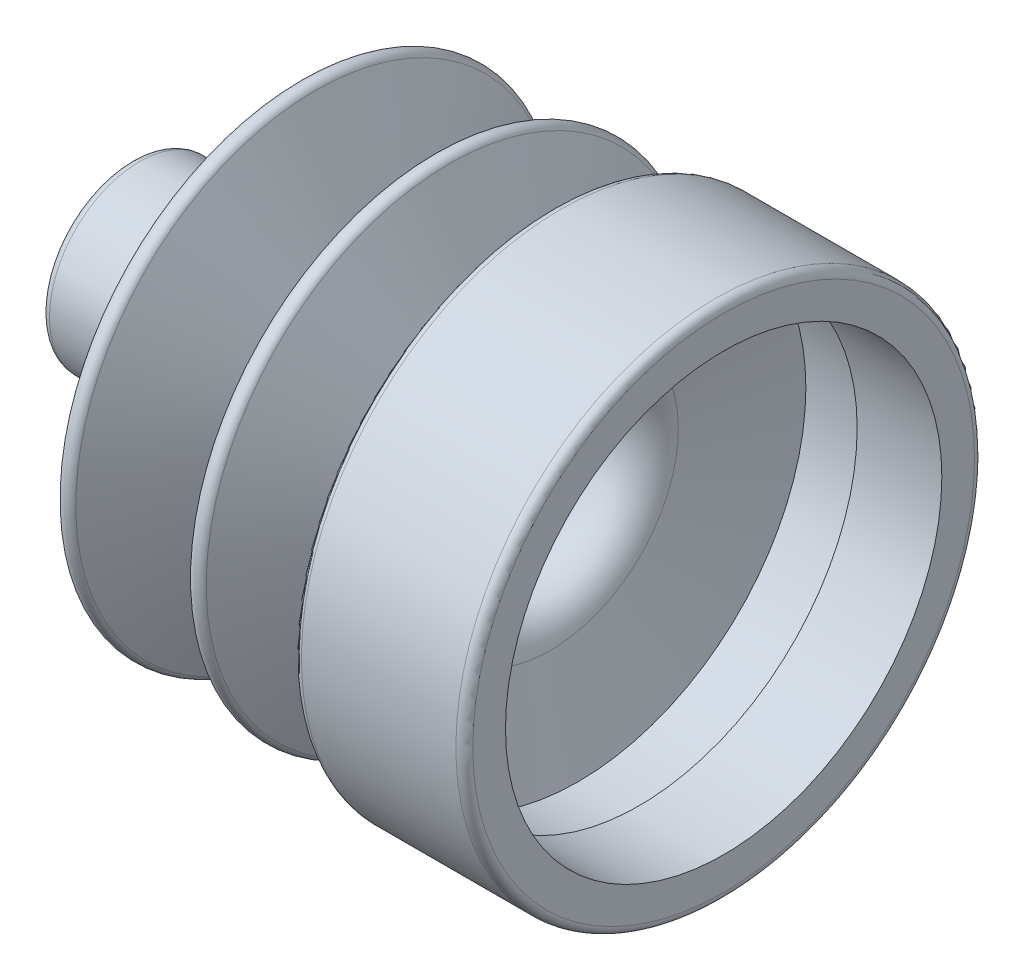
from build123d import *

# Parameters (mm, degrees)
SKETCH2_W          = 6.35
SKETCH2_H          = 0.79375
CUT_EXTRUDE1_REACH = 54.27
SKETCH3_R          = 3.96875


# Read off the part's stored shape, not the designer's step: Shell1
with BuildPart() as part:
    # Sketch1 → Revolve1 (revolve)
    with BuildSketch(Plane.XY):
        with BuildLine():
            Line((0, 0), (0, 18.811875))
            ThreePointArc((0, 18.811875), (-0.185987194, 19.260887806), (-0.635, 19.446875))
            Line((-0.635, 19.446875), (-12.219799826, 19.446875))
            ThreePointArc((-12.219799826, 19.446875), (-12.602813277, 19.318358659), (-12.830792122, 18.98482995))
            Line((-12.830792122, 18.98482995), (-15.300954332, 10.258568717))
            ThreePointArc((-15.300954332, 10.258568717), (-15.851484992, 9.799408653), (-16.479074262, 10.145881854))
            Line((-16.479074262, 10.145881854), (-20.558643019, 18.245663037))
            ThreePointArc((-20.558643019, 18.245663037), (-21.141942917, 18.594815252), (-21.706707389, 18.216414499))
            Line((-21.706707389, 18.216414499), (-25.368545199, 9.919410201))
            ThreePointArc((-25.368545199, 9.919410201), (-25.933309671, 9.541009448), (-26.516609568, 9.890161663))
            Line((-26.516609568, 9.890161663), (-30.596178325, 17.989942846))
            ThreePointArc((-30.596178325, 17.989942846), (-31.223767596, 18.336416047), (-31.774298256, 17.877255983))
            Line((-31.774298256, 17.877255983), (-34.794207878, 7.20892005))
            ThreePointArc((-34.794207878, 7.20892005), (-35.022186723, 6.875391341), (-35.405200174, 6.746875))
            Line((-35.405200174, 6.746875), (-43.815, 6.746875))
            ThreePointArc((-43.815, 6.746875), (-44.264012806, 6.560887806), (-44.45, 6.111875))
            Line((-44.45, 6.111875), (-44.45, 0))
            Line((-44.45, 0), (0, 0))
        make_face()
    revolve(axis=Axis((0, 0, 0), (-1, 0, 0)))

    # Shell1 outline → Shell1 (revolve, cut)
    with BuildSketch(Plane.YX):
        with BuildLine():
            Line((0, 0), (0, -42.06875))
            Line((0, -42.06875), (4.365625, -42.06875))
            Line((4.365625, -42.06875), (4.365625, -35.405200174))
            ThreePointArc((4.365625, -35.405200174), (4.97607762, -33.585886284), (6.560338986, -32.50298677))
            Line((6.560338986, -32.50298677), (12.912222623, -30.704944917))
            Line((12.912222623, -30.704944917), (8.819004864, -28.643338201))
            ThreePointArc((8.819004864, -28.643338201), (7.160531843, -25.872663689), (8.957935423, -23.190032446))
            Line((8.957935423, -23.190032446), (13.871173342, -21.02160156))
            Line((13.871173342, -21.02160156), (9.074725055, -18.605802895))
            ThreePointArc((9.074725055, -18.605802895), (7.428977352, -15.624753859), (9.609987653, -13.009733224))
            Line((9.609987653, -13.009733224), (17.065625, -10.899249348))
            Line((17.065625, -10.899249348), (17.065625, 0))
            Line((17.065625, 0), (0, 0))
        make_face()
    revolve(axis=Axis((0, 0, 0), (1, 0, 0)), mode=Mode.SUBTRACT)

    # Sketch2 → Revolve2 (revolve)
    with BuildSketch(Plane.XY):
        with Locations((-3.175, 16.75949892)):
            Rectangle(SKETCH2_W, SKETCH2_H)
    revolve(axis=Axis((-56.558240413, 0, 0), (1, 0, 0)))

    # Sketch3 → Cut-Extrude1 (cut, up to next)
    with BuildSketch(Plane.ZY.offset(44.45), mode=Mode.PRIVATE) as cut_extrude1_sk1:
        with Locations(Location((0, 0, 0), (0, 0, 270))):
            Circle(SKETCH3_R)
    cut_extrude1_tool1 = extrude(cut_extrude1_sk1.sketch, amount=-CUT_EXTRUDE1_REACH, mode=Mode.PRIVATE) & part.part
    add(cut_extrude1_tool1.solids().sort_by_distance((-44.45, 0, 0))[0], mode=Mode.SUBTRACT)


solid = part.part
